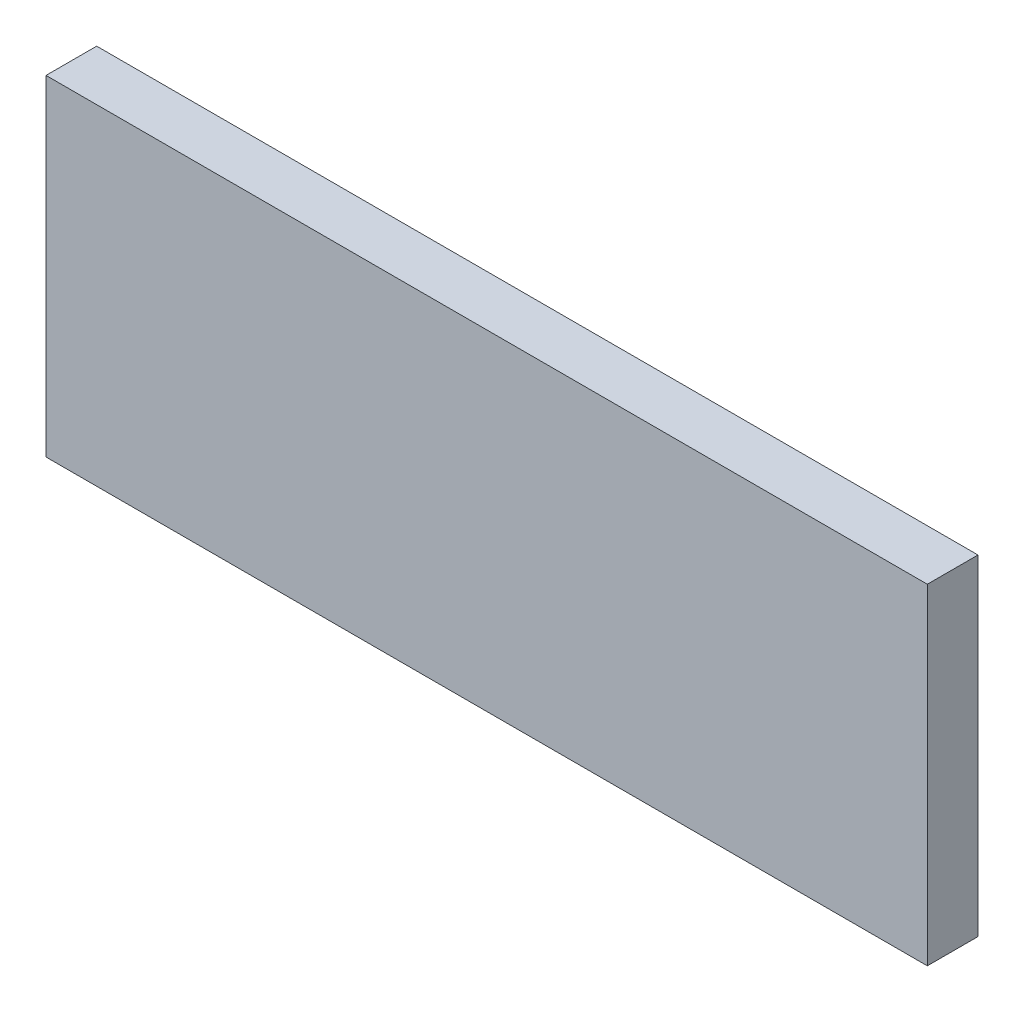
from build123d import *

# Parameters (mm, degrees)
SKETCH1_W           = 50.8
SKETCH1_H           = 19.05
BOSS_EXTRUDE1_DEPTH = 2.921


with BuildPart() as part:
    # Sketch1 → Boss-Extrude1 (new body)
    with BuildSketch(Plane.XY):
        with Locations((25.4, 9.525)):
            Rectangle(SKETCH1_W, SKETCH1_H)
    extrude(amount=-BOSS_EXTRUDE1_DEPTH)


solid = part.part
